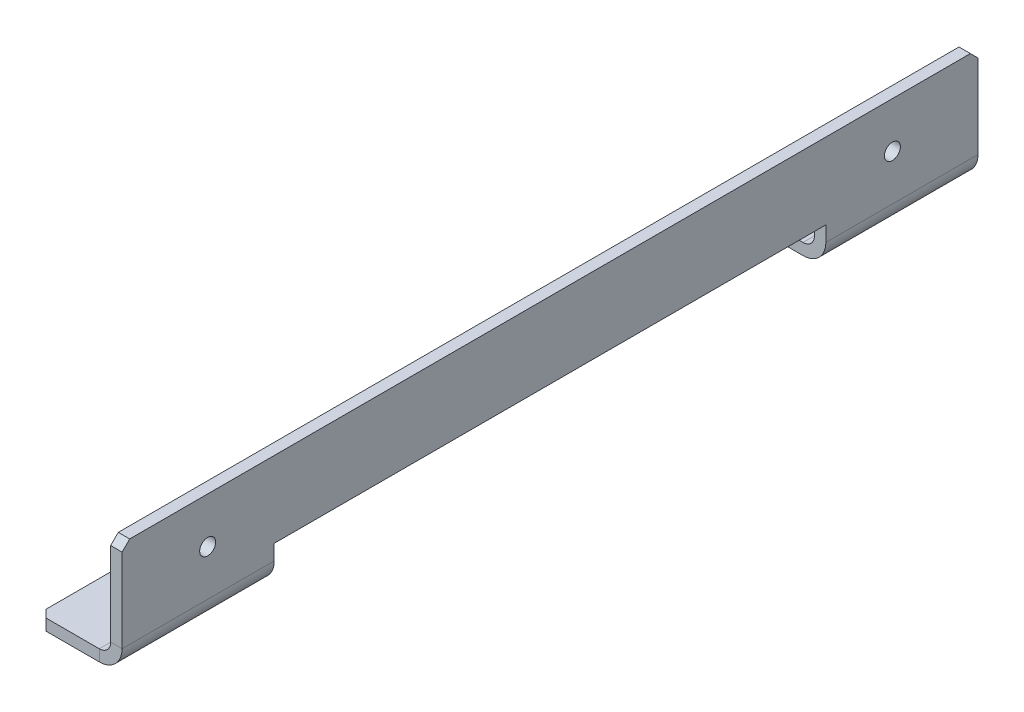
from build123d import *

# Parameters (mm, degrees)
BASE_FLANGE1_DEPTH    = 112.5
SKETCH4_R             = 2.75
CUT_EXTRUDE1_DEPTH    = 10
SKETCH5_W             = 145
SKETCH5_H             = 10
CUT_EXTRUDE2_DEPTH    = 70
CHAMFER1_SIZE         = 2
M5_TAPPED_HOLE1_D     = 4.2
M5_TAPPED_HOLE1_DEPTH = 12.4
M5_TAPPED_HOLE1_TIP   = 1.2618073


# Sheet-metal steps are written as plain solids
with BuildPart() as part:
    # Sketch1 → Base-Flange1 (new, symmetric)
    with BuildSketch(Plane.XY):
        with BuildLine():
            Line((0, 30), (0, 6))
            ThreePointArc((0, 6), (-1.757359313, 1.757359313), (-6, 0))
            Line((-6, 0), (-22, 0))
            Line((-22, 0), (-22, 3))
            Line((-22, 3), (-6, 3))
            ThreePointArc((-6, 3), (-3.878679656, 3.878679656), (-3, 6))
            Line((-3, 6), (-3, 30))
            Line((-3, 30), (0, 30))
        make_face()
    extrude(amount=BASE_FLANGE1_DEPTH, both=True)

    # Sketch4 → Cut-Extrude1 (cut)
    with BuildSketch(Plane(origin=(0, 3, 0), x_dir=(1, 0, 0), z_dir=(0, 1, 0))):
        with Locations(Location((-14, -90, 0), (0, 0, 180))):
            Circle(SKETCH4_R)
        with Locations((-14, 90)):
            Circle(SKETCH4_R)
    extrude(amount=-CUT_EXTRUDE1_DEPTH, mode=Mode.SUBTRACT)

    # Sketch5 → Cut-Extrude2 (cut)
    with BuildSketch(Plane(origin=(0, 0, 0), x_dir=(0, 0, -1), z_dir=(1, 0, 0))):
        with Locations((0, 5)):
            Rectangle(SKETCH5_W, SKETCH5_H)
    extrude(amount=-CUT_EXTRUDE2_DEPTH, mode=Mode.SUBTRACT)

    # Chamfer1
    chamfer1_edges = [part.edges().sort_by_distance(p)[0] for p in [
        (-1.5, 30, 112.5),
        (-22, 1.5, 72.5),
        (-22, 1.5, -72.5),
        (-22, 1.5, 112.5),
        (-1.5, 30, -112.5),
        (-22, 1.5, -112.5),
    ]]
    chamfer(chamfer1_edges, length=CHAMFER1_SIZE)

    # M5 Tapped Hole1
    with Locations(Plane(origin=(0, 18, 90), x_dir=(0, 0, 1), z_dir=(1, 0, 0))):
        with Locations((0, 0), (-180, 0)):
            Hole(M5_TAPPED_HOLE1_D / 2, depth=M5_TAPPED_HOLE1_DEPTH)
            with Locations((0, 0, -(M5_TAPPED_HOLE1_DEPTH + M5_TAPPED_HOLE1_TIP / 2))):  # 118° drill point
                Cone(0, M5_TAPPED_HOLE1_D / 2, M5_TAPPED_HOLE1_TIP, mode=Mode.SUBTRACT)


solid = part.part
